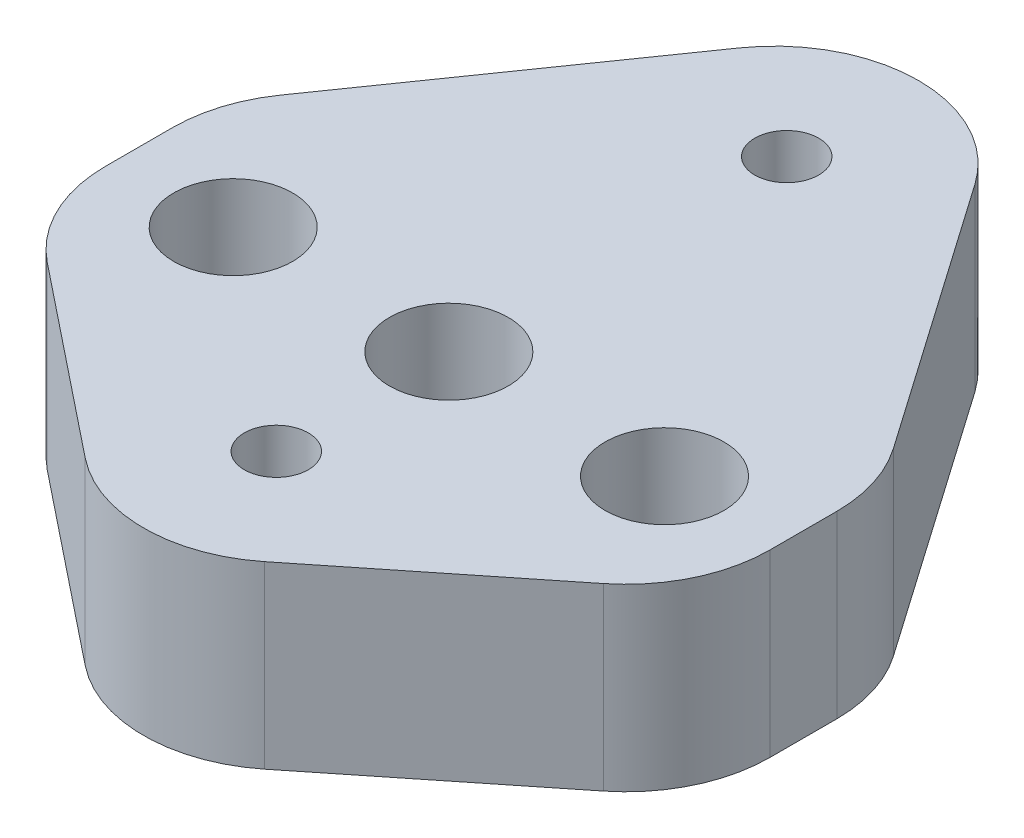
from build123d import *

# Parameters (mm, degrees)
SKETCH1_R           = 2.1
SKETCH1_R_2         = 1.1303
BOSS_EXTRUDE1_DEPTH = 6.35


with BuildPart() as part:
    # Sketch1 → Boss-Extrude1 (new body)
    with BuildSketch(Plane(origin=(0, 0, 0), x_dir=(1, 0, 0), z_dir=(0, 1, 0))):
        with BuildLine():
            Line((-4.166356908, 14.422535083), (-10.824244408, 4.878779484))
            ThreePointArc((-10.824244408, 4.878779484), (-11.504097003, 3.4956266), (-11.7378875, 1.972257487))
            Line((-11.7378875, 1.972257487), (-11.7378875, -0.391312991))
            ThreePointArc((-11.7378875, -0.391312991), (-11.235563405, -2.593875887), (-9.82793344, -4.360848069))
            Line((-9.82793344, -4.360848069), (-3.17004594, -9.677795476))
            ThreePointArc((-3.17004594, -9.677795476), (0, -10.788260398), (3.17004594, -9.677795476))
            Line((3.17004594, -9.677795476), (9.82793344, -4.360848069))
            ThreePointArc((9.82793344, -4.360848069), (11.235563405, -2.593875887), (11.7378875, -0.391312991))
            Line((11.7378875, -0.391312991), (11.7378875, 1.972257487))
            ThreePointArc((11.7378875, 1.972257487), (11.504097003, 3.4956266), (10.824244408, 4.878779484))
            Line((10.824244408, 4.878779484), (4.166356908, 14.422535083))
            ThreePointArc((4.166356908, 14.422535083), (0, 16.596013086), (-4.166356908, 14.422535083))
        make_face()
        with Locations((-7.62, 0)):
            Circle(SKETCH1_R, mode=Mode.SUBTRACT)
        Circle(SKETCH1_R, mode=Mode.SUBTRACT)
        with Locations((7.62, 0)):
            Circle(SKETCH1_R, mode=Mode.SUBTRACT)
        with Locations((0, 11.938)):
            Circle(SKETCH1_R_2, mode=Mode.SUBTRACT)
        with Locations((0, -6.096)):
            Circle(SKETCH1_R_2, mode=Mode.SUBTRACT)
    extrude(amount=BOSS_EXTRUDE1_DEPTH)


solid = part.part
